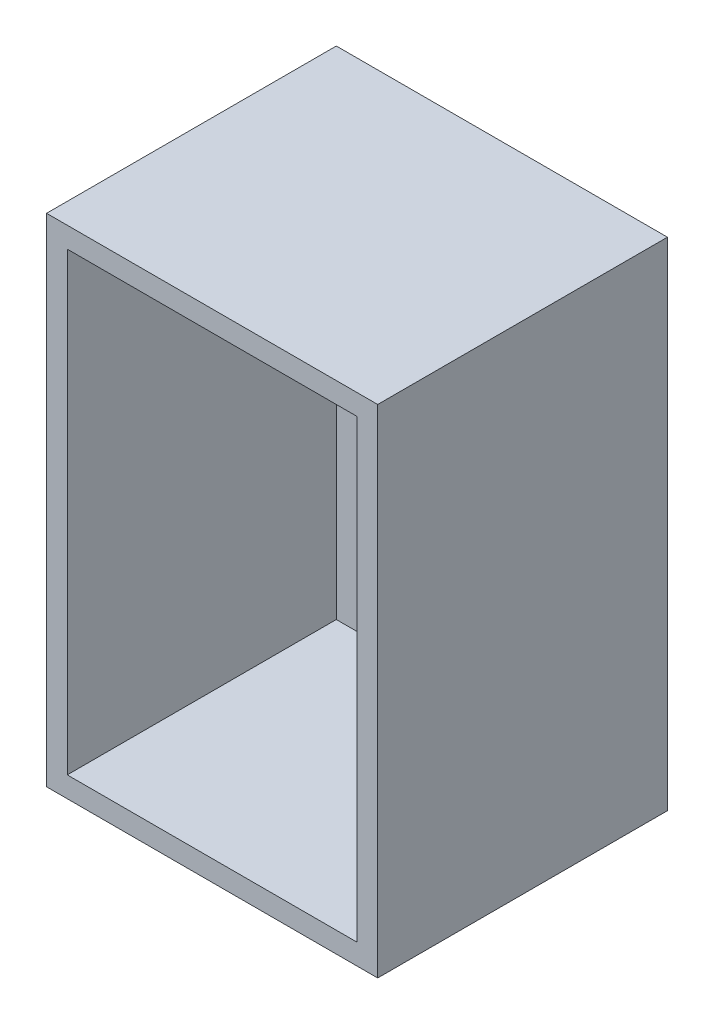
from build123d import *

# Parameters (mm, degrees)
SKETCH4_W           = 40
SKETCH4_H           = 60
BOSS_EXTRUDE2_DEPTH = 35
SKETCH5_OUTSIDE_W   = 58.032
SKETCH5_OUTSIDE_H   = 78.032
SKETCH5_OUTSIDE_W_2 = 40
SKETCH5_OUTSIDE_H_2 = 60
SKETCH5_OUTSIDE_W_3 = 35
SKETCH5_OUTSIDE_H_3 = 55
CUT_EXTRUDE1_DEPTH  = 32.5


with BuildPart() as part:
    # Sketch4 → Boss-Extrude2 (new body)
    with BuildSketch(Plane.XY):
        with Locations((-5.284904398, -9.439291809)):
            Rectangle(SKETCH4_W, SKETCH4_H)
    extrude(amount=BOSS_EXTRUDE2_DEPTH)

    # Sketch5 outside → Cut-Extrude1 (cut)
    # profile 1 of 2: a face of its own
    with BuildSketch(Plane.XY.offset(35)):
        with Locations((-5.285, -9.439)):
            Rectangle(SKETCH5_OUTSIDE_W, SKETCH5_OUTSIDE_H)
        with Locations((-5.284904398, -9.439291809)):
            Rectangle(SKETCH5_OUTSIDE_W_2, SKETCH5_OUTSIDE_H_2, mode=Mode.SUBTRACT)
    # profile 2 of 2: a face of its own
    with BuildSketch(Plane.XY.offset(35)):
        with Locations((-5.284904398, -9.439291809)):
            Rectangle(SKETCH5_OUTSIDE_W_3, SKETCH5_OUTSIDE_H_3)
    extrude(amount=-CUT_EXTRUDE1_DEPTH, mode=Mode.SUBTRACT)


solid = part.part
